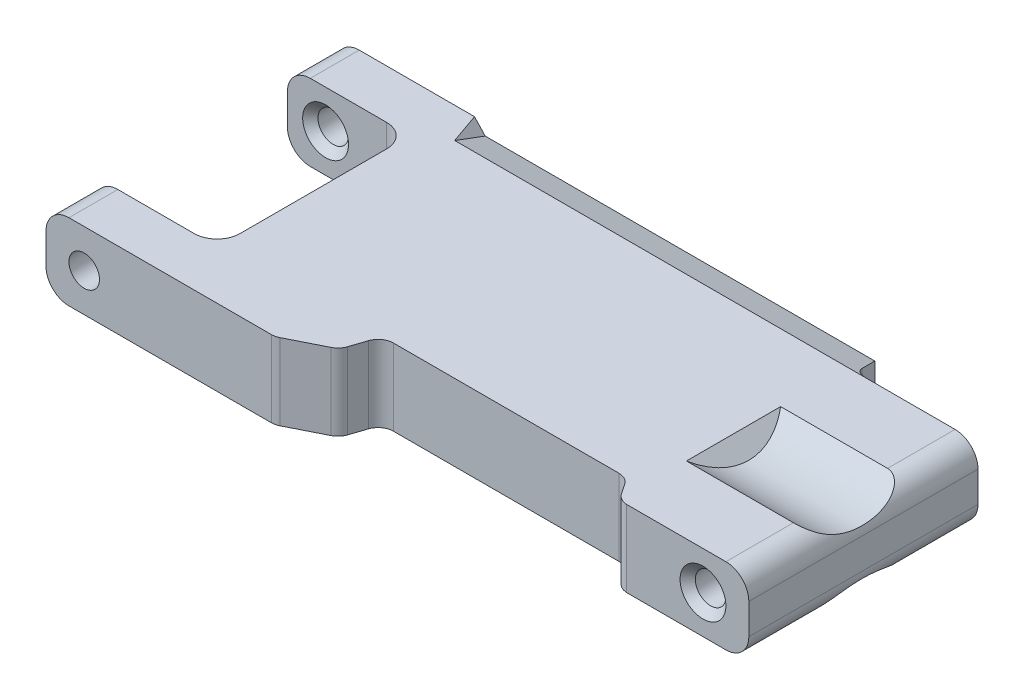
from build123d import *

# Parameters (mm, degrees)
BOSS_EXTRUDE1_DEPTH           = 10
FILLET1_R                     = 3
CUT_EXTRUDE1_DEPTH            = 55.386
CHAMFER1_SIZE                 = 1.5
MIRROR3_START                 = -3.745316975
MIRROR3_DEPTH                 = 4.272002108
CSK_FOR_M4_SFHCS1_D           = 4
CSK_FOR_M4_SFHCS1_DEPTH       = 6.4
CSK_FOR_M4_SFHCS1_CSINK_D     = 6
CSK_FOR_M4_SFHCS1_CSINK_ANGLE = 90
CSK_FOR_M4_SFHCS2_D           = 4
CSK_FOR_M4_SFHCS2_CSINK_D     = 6
CSK_FOR_M4_SFHCS2_CSINK_ANGLE = 90
SKETCH7_R                     = 1.5
CUT_EXTRUDE2_DEPTH            = 24
SKETCH8_R                     = 10.5
CUT_EXTRUDE3_DEPTH            = 15
CHAMFER2_SIZE                 = 2


# Read off the part's stored shape, not the designer's step: Mirror3
with BuildPart() as part:
    # Sketch1 → Boss-Extrude1 (new body)
    with BuildSketch(Plane(origin=(0, 0, 0), x_dir=(1, 0, 0), z_dir=(0, 1, 0))):
        with BuildLine():
            Line((-35.25, 0), (-35.25, -6.4))
            Line((-35.25, -6.4), (-22.25, -6.4))
            ThreePointArc((-22.25, -6.4), (-20.128679656, -7.278679656), (-19.25, -9.4))
            Line((-19.25, -9.4), (-19.25, -28.6))
            ThreePointArc((-19.25, -28.6), (-20.128679656, -30.721320344), (-22.25, -31.6))
            Line((-22.25, -31.6), (-35.25, -31.6))
            Line((-35.25, -31.6), (-35.25, -38))
            Line((-35.25, -38), (-5.75, -38))
            ThreePointArc((-5.75, -38), (-5.289009014, -37.946146786), (-4.852843875, -37.787487311))
            Line((-4.852843875, -37.787487311), (-0.384125597, -35.544596998))
            ThreePointArc((-0.384125597, -35.544596998), (0.230625744, -35.066359782), (0.616084961, -34.389564956))
            Line((0.616084961, -34.389564956), (1.30066574, -32.33582167))
            ThreePointArc((1.30066574, -32.33582167), (2.028611742, -31.34579265), (3.198032424, -30.968276939))
            Line((3.198032424, -30.968276939), (32.698032424, -30.968276939))
            ThreePointArc((32.698032424, -30.968276939), (33.642903174, -31.205546312), (34.363585035, -31.861057674))
            Line((34.363585035, -31.861057674), (35.193999483, -33.110222133))
            ThreePointArc((35.193999483, -33.110222133), (35.866740637, -33.73918414), (36.750000973, -34.000000252))
            Line((36.750000973, -34.000000252), (52.750000973, -34.000000252))
            Line((52.750000973, -34.000000252), (52.750000973, -4.000000252))
            Line((52.750000973, -4.000000252), (38.13600074, -4.000000252))
            ThreePointArc((38.13600074, -4.000000252), (36.996810987, -3.643851433), (36.263342318, -2.702246958))
            Line((36.263342318, -2.702246958), (35.25, 0))
            Line((35.25, 0), (-35.25, 0))
        make_face()
    extrude(amount=BOSS_EXTRUDE1_DEPTH)

    # Fillet1
    fillet1_edges = [part.edges().sort_by_distance(p)[0] for p in [
        (52.750000973, 0, 19.000000252),
        (-35.25, 0, 34.8),
        (-35.25, 0, 3.2),
        (-35.25, 10, 34.8),
        (52.750000973, 10, 19.000000252),
        (-35.25, 10, 3.2),
    ]]
    fillet(fillet1_edges, radius=FILLET1_R)

    # Sketch2 → Cut-Extrude1 (cut)
    with BuildSketch(Plane(origin=(38.13600074, 0, 0), x_dir=(0, 0, -1), z_dir=(1, 0, 0))):
        Polygon((-4.000000252, 10), (0, 10), (0, 8.5), align=None)
    extrude(amount=-CUT_EXTRUDE1_DEPTH, mode=Mode.SUBTRACT)

    # Chamfer1
    # the kernel refuses this chamfer: 1.5 mm, written as the material it adds along each edge
    with BuildSketch(Plane(origin=(-17.24999926, 7.145532803, -3.611912754), x_dir=(-0.027495876610586757, 0.9359751746095561, -0.35099066837171944), z_dir=(0, 0.3511234221997007, 0.9363291848398034))) as chamfer1_piece_1_section:
        Polygon((CHAMFER1_SIZE * 0.999621916911, -CHAMFER1_SIZE * 0.0274958766106), (-CHAMFER1_SIZE * 0.0274958766106, -CHAMFER1_SIZE * 0.999621916911), (0, 0), align=None)
    chamfer1_piece_1 = extrude(amount=11.987051072, mode=Mode.PRIVATE)
    chamfer1_piece_1 = split(chamfer1_piece_1, bisect_by=Plane(origin=(-16.68097762, 9.443284972, 0), z_dir=(0, 0, 1)), keep=Keep.TOP, mode=Mode.PRIVATE)
    chamfer1_piece_1 = split(chamfer1_piece_1, bisect_by=Plane(origin=(-16.68097762, 10, 1.484573502), z_dir=(0, -1, 0)), keep=Keep.TOP, mode=Mode.PRIVATE)
    add(chamfer1_piece_1)

    # Mirror3 outline → Mirror3 (cut)
    with BuildSketch(Plane(origin=(0, 0, 0), x_dir=(1, 0, 0), z_dir=(0, 0.3511234221997011, -0.9363291848398033)).offset(MIRROR3_START)):
        Polygon((-15.74999926, -1.404493777), (40, -1.404493777), (40, 2), (-19, 2), (-19, 1.845506963), align=None)
    extrude(amount=MIRROR3_DEPTH, mode=Mode.SUBTRACT)

    # CSK for M4 SFHCS1
    with Locations(Plane.XY.offset(6.4)):
        with Locations((-30.25, 5)):
            csk_for_m4_sfhcs1 = CounterSinkHole(CSK_FOR_M4_SFHCS1_D / 2, CSK_FOR_M4_SFHCS1_CSINK_D / 2, depth=CSK_FOR_M4_SFHCS1_DEPTH, counter_sink_angle=CSK_FOR_M4_SFHCS1_CSINK_ANGLE)

    # Mirror1: CSK for M4 SFHCS1 across plane
    add(csk_for_m4_sfhcs1.mirror(Plane.XY.offset(19)), mode=Mode.SUBTRACT)

    # CSK for M4 SFHCS2 (through all)
    with Locations(Plane.XY.offset(34.000000252)):
        with Locations((46.750000973, 5)):
            csk_for_m4_sfhcs2 = CounterSinkHole(CSK_FOR_M4_SFHCS2_D / 2, CSK_FOR_M4_SFHCS2_CSINK_D / 2, counter_sink_angle=CSK_FOR_M4_SFHCS2_CSINK_ANGLE)

    # Mirror2: CSK for M4 SFHCS2 across plane
    add(csk_for_m4_sfhcs2.mirror(Plane.XY.offset(19)), mode=Mode.SUBTRACT)

    # Sketch7 → Cut-Extrude2 (cut)
    with BuildSketch(Plane(origin=(0, 0, 0), x_dir=(-1, 0, 0), z_dir=(0, 0, -1))):
        with Locations((-31.25, 5)):
            Circle(SKETCH7_R)
        with Locations((-23.75, 5)):
            Circle(SKETCH7_R)
        with Locations((-16.25, 5)):
            Circle(SKETCH7_R)
        with Locations((-8.75, 5)):
            Circle(SKETCH7_R)
        with Locations((-1.25, 5)):
            Circle(SKETCH7_R)
        with Locations((6.25, 5)):
            Circle(SKETCH7_R)
        with Locations((13.75, 5)):
            Circle(SKETCH7_R)
    extrude(amount=-CUT_EXTRUDE2_DEPTH, mode=Mode.SUBTRACT)

    # Sketch8 → Cut-Extrude3 (cut)
    with BuildSketch(Plane(origin=(52.750000973, 0, 0), x_dir=(0, 0, -1), z_dir=(1, 0, 0))):
        with Locations((-19.000000252, 18.5)):
            Circle(SKETCH8_R)
        with Locations((-19.000000252, -8.5)):
            Circle(SKETCH8_R)
    extrude(amount=-CUT_EXTRUDE3_DEPTH, mode=Mode.SUBTRACT)

    # Chamfer2
    # the kernel refuses this chamfer: 2 mm, written as the material it adds along each edge
    # the kernel refuses this chamfer: 2 mm, written as the material it takes off along each edge
    with BuildSketch(Plane(origin=(37.750000973, 10, 7.692220273), x_dir=(-0.9996219169112968, 0.02749587661058651, 0), z_dir=(0, 0, 1))) as chamfer2_2_piece_1_section:
        Polygon((CHAMFER2_SIZE * 0.999621916911, CHAMFER2_SIZE * 0.0274958766106), (-CHAMFER2_SIZE * 0.0274958766106, CHAMFER2_SIZE * 0.999621916911), (0, 0), align=None)
    chamfer2_2_piece_1 = extrude(amount=22.615559958, mode=Mode.PRIVATE)
    chamfer2_2_piece_1 = chamfer2_2_piece_1 & Plane(origin=(37.038023767, 18.5, 19.000000252), x_dir=(0, 0, -1), z_dir=(1, 0, 0)) * Cylinder(10.5, 54, mode=Mode.PRIVATE)
    add(chamfer2_2_piece_1, mode=Mode.SUBTRACT)
    with BuildSketch(Plane(origin=(37.750000973, 0, 30.307780231), x_dir=(-0.9996219169112968, -0.02749587661058639, 0), z_dir=(0, 0, -1))) as chamfer2_2_piece_2_section:
        Polygon((CHAMFER2_SIZE * 0.999621916911, CHAMFER2_SIZE * 0.0274958766106), (-CHAMFER2_SIZE * 0.0274958766106, CHAMFER2_SIZE * 0.999621916911), (0, 0), align=None)
    chamfer2_2_piece_2 = extrude(amount=22.615559958, mode=Mode.PRIVATE)
    chamfer2_2_piece_2 = chamfer2_2_piece_2 & Plane(origin=(37.038023767, -8.5, 19.000000252), x_dir=(0, 0, -1), z_dir=(1, 0, 0)) * Cylinder(10.5, 54, mode=Mode.PRIVATE)
    add(chamfer2_2_piece_2, mode=Mode.SUBTRACT)


solid = part.part
